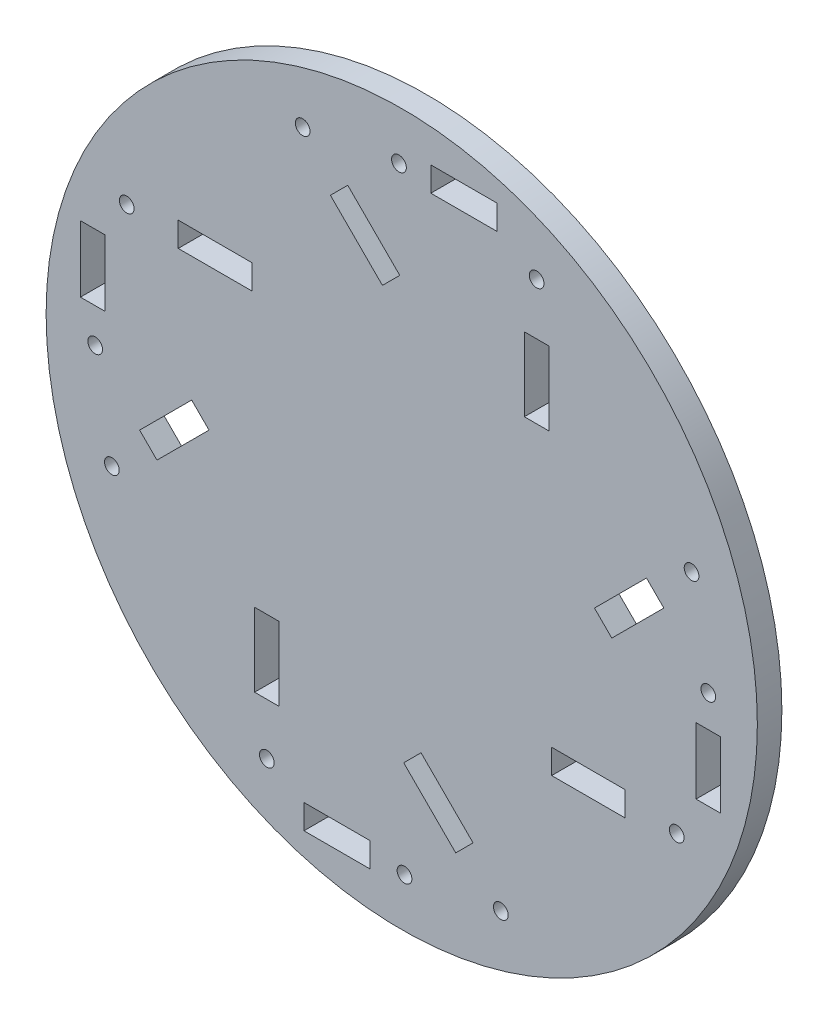
from build123d import *

# Parameters (mm, degrees)
SKETCH1_R           = 72.5
SKETCH1_R_2         = 1.5
SKETCH1_W           = 13.5
SKETCH1_H           = 5
SKETCH1_W_2         = 5
SKETCH1_H_2         = 15
SKETCH1_W_3         = 15
SKETCH1_H_3         = 13.5
BOSS_EXTRUDE1_DEPTH = 5


with BuildPart() as part:
    # Sketch1 → Boss-Extrude1 (new body)
    with BuildSketch(Plane.XY):
        Circle(SKETCH1_R)
        with Locations((-27.5, -56.065506466)):
            Circle(SKETCH1_R_2, mode=Mode.SUBTRACT)
        with Locations((-13.184493534, -62.5)):
            Rectangle(SKETCH1_W, SKETCH1_H, mode=Mode.SUBTRACT)
        with Locations((-27.5, -38.065506466)):
            Rectangle(SKETCH1_W_2, SKETCH1_H_2, mode=Mode.SUBTRACT)
        with Locations((-59.089736296, -20.19886333)):
            Circle(SKETCH1_R_2, mode=Mode.SUBTRACT)
        with Locations((-62.5, -0.565506466)):
            Circle(SKETCH1_R_2, mode=Mode.SUBTRACT)
        Polygon((-42.826280328, -0.399873457), (-39.290746422, -3.935407363), (-49.89734814, -14.542009081), (-53.432882046, -11.006475175), align=None, mode=Mode.SUBTRACT)
        with Locations((0.565506466, -62.5)):
            Circle(SKETCH1_R_2, mode=Mode.SUBTRACT)
        with Locations((20.19886333, -59.089736296)):
            Circle(SKETCH1_R_2, mode=Mode.SUBTRACT)
        Polygon((0.399873457, -42.826280328), (3.935407363, -39.290746422), (14.542009081, -49.89734814), (11.006475175, -53.432882046), align=None, mode=Mode.SUBTRACT)
        with Locations((38.065506466, -27.5)):
            Rectangle(SKETCH1_W_3, SKETCH1_H, mode=Mode.SUBTRACT)
        with Locations((56.065506466, -27.5)):
            Circle(SKETCH1_R_2, mode=Mode.SUBTRACT)
        with Locations((62.5, -12.684493534)):
            Rectangle(SKETCH1_W_2, SKETCH1_H_3, mode=Mode.SUBTRACT)
        with Locations((-63, 13.184493534)):
            Rectangle(SKETCH1_W_2, SKETCH1_H_3, mode=Mode.SUBTRACT)
        with Locations((-56.065506466, 27.5)):
            Circle(SKETCH1_R_2, mode=Mode.SUBTRACT)
        with Locations((-38.065506466, 27.5)):
            Rectangle(SKETCH1_W_3, SKETCH1_H, mode=Mode.SUBTRACT)
        Polygon((-0.399873457, 42.826280328), (-3.935407363, 39.290746422), (-14.542009081, 49.89734814), (-11.006475175, 53.432882046), align=None, mode=Mode.SUBTRACT)
        with Locations((-20.19886333, 59.089736296)):
            Circle(SKETCH1_R_2, mode=Mode.SUBTRACT)
        with Locations((-0.565506466, 62.5)):
            Circle(SKETCH1_R_2, mode=Mode.SUBTRACT)
        Polygon((42.826280328, 0.399873457), (39.290746422, 3.935407363), (49.89734814, 14.542009081), (53.432882046, 11.006475175), align=None, mode=Mode.SUBTRACT)
        with Locations((62.5, 0.565506466)):
            Circle(SKETCH1_R_2, mode=Mode.SUBTRACT)
        with Locations((59.089736296, 20.19886333)):
            Circle(SKETCH1_R_2, mode=Mode.SUBTRACT)
        with Locations((27.5, 38.065506466)):
            Rectangle(SKETCH1_W_2, SKETCH1_H_2, mode=Mode.SUBTRACT)
        with Locations((12.684493534, 63)):
            Rectangle(SKETCH1_W, SKETCH1_H, mode=Mode.SUBTRACT)
        with Locations((27.5, 56.065506466)):
            Circle(SKETCH1_R_2, mode=Mode.SUBTRACT)
    extrude(amount=BOSS_EXTRUDE1_DEPTH)


solid = part.part
